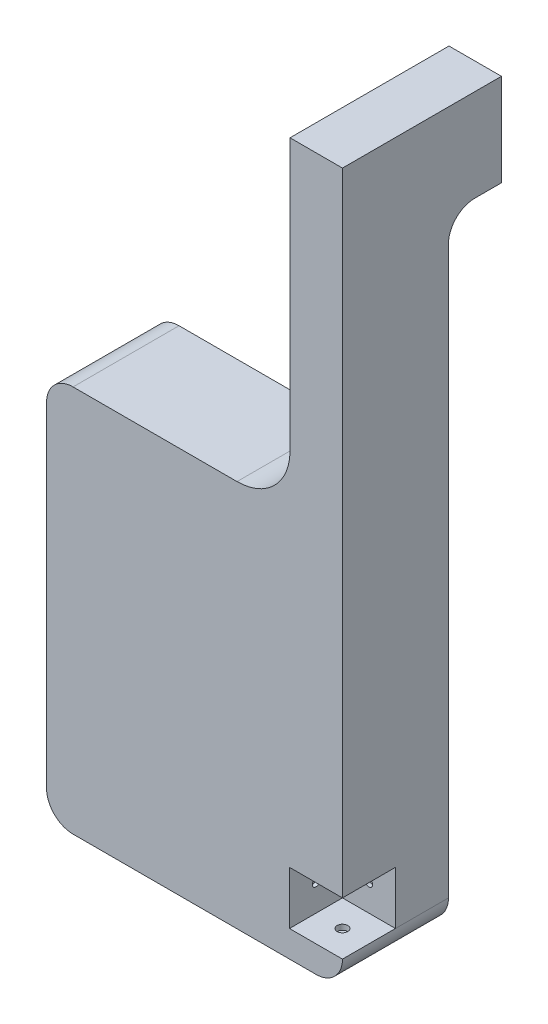
from build123d import *

# Parameters (mm, degrees)
BOSS_EXTRUDE1_DEPTH = 5.08
SKETCH2_W           = 2.514342879
SKETCH2_H           = 4.423428586
BOSS_EXTRUDE2_DEPTH = 2.54
FILLET1_R           = 1.27
SKETCH3_W           = 2.54
SKETCH3_H           = 2.54
CUT_EXTRUDE5_DEPTH  = 2.54
SKETCH7_R           = 0.254
CUT_EXTRUDE6_DEPTH  = 0.254
CUT_EXTRUDE7_START  = -0.254
SKETCH8_R           = 0.254
CUT_EXTRUDE7_DEPTH  = 0.254
SKETCH9_R           = 0.1778
CUT_EXTRUDE8_DEPTH  = 0.1778
SKETCH10_R          = 0.1778
CUT_EXTRUDE9_DEPTH  = 0.1778


with BuildPart() as part:
    # Sketch1 → Boss-Extrude1 (new body)
    with BuildSketch(Plane.XY):
        with BuildLine():
            Line((4.20382112, 20.558512794), (4.20382112, 23.475460042))
            Line((4.20382112, 23.475460042), (6.718163999, 23.475460042))
            Line((6.718163999, 23.475460042), (6.718163999, -9.362397134))
            ThreePointArc((6.718163999, -9.362397134), (6.346189611, -10.260422746), (5.448163999, -10.632397134))
            Line((5.448163999, -10.632397134), (-6.195748899, -10.632397134))
            ThreePointArc((-6.195748899, -10.632397134), (-7.093774512, -10.260422746), (-7.465748899, -9.362397134))
            Line((-7.465748899, -9.362397134), (-7.465748899, 6.663612766))
            ThreePointArc((-7.465748899, 6.663612766), (-7.093774512, 7.561638378), (-6.195748899, 7.933612766))
            Line((-6.195748899, 7.933612766), (1.66382112, 7.933612766))
            ThreePointArc((1.66382112, 7.933612766), (3.459872344, 8.677561542), (4.20382112, 10.473612766))
            Line((4.20382112, 10.473612766), (4.20382112, 20.558512794))
        make_face()
    extrude(amount=BOSS_EXTRUDE1_DEPTH)

    # Sketch2 → Boss-Extrude2 (add)
    with BuildSketch(Plane(origin=(0, 0, 0), x_dir=(-1, 0, 0), z_dir=(0, 0, -1))):
        with Locations((-5.46099256, 21.263745749)):
            Rectangle(SKETCH2_W, SKETCH2_H)
    extrude(amount=BOSS_EXTRUDE2_DEPTH)

    # Fillet1
    fillet1_edges = [part.edges().sort_by_distance(p)[0] for p in [
        (5.46099256, 19.052031456, 0),
    ]]
    fillet(fillet1_edges, radius=FILLET1_R)

    # Sketch3 → Cut-Extrude5 (cut)
    with BuildSketch(Plane.XY.offset(5.08)):
        with Locations((5.448163999, -8.092397134)):
            Rectangle(SKETCH3_W, SKETCH3_H)
    extrude(amount=-CUT_EXTRUDE5_DEPTH, mode=Mode.SUBTRACT)

    # Sketch7 → Cut-Extrude6 (cut)
    with BuildSketch(Plane.XZ.offset(6.822397134)):
        with Locations((5.448163999, 3.81)):
            Circle(SKETCH7_R)
    extrude(amount=-CUT_EXTRUDE6_DEPTH, mode=Mode.SUBTRACT)

    # Sketch8 → Cut-Extrude7 (cut)
    with BuildSketch(Plane(origin=(0, -9.362397134, 0), x_dir=(1, 0, 0), z_dir=(0, 1, 0)).offset(CUT_EXTRUDE7_START)):
        with Locations((5.448163999, -3.81)):
            Circle(SKETCH8_R)
    extrude(amount=CUT_EXTRUDE7_DEPTH, mode=Mode.SUBTRACT)

    # Sketch9 → Cut-Extrude8 (cut)
    with BuildSketch(Plane(origin=(4.178163999, 0, 0), x_dir=(0, 0, -1), z_dir=(1, 0, 0))):
        with Locations((-3.81, -8.092397134)):
            Circle(SKETCH9_R)
    extrude(amount=-CUT_EXTRUDE8_DEPTH, mode=Mode.SUBTRACT)

    # Sketch10 → Cut-Extrude9 (cut)
    with BuildSketch(Plane.XY.offset(2.54)):
        with Locations((5.448163999, -8.092397134)):
            Circle(SKETCH10_R)
    extrude(amount=-CUT_EXTRUDE9_DEPTH, mode=Mode.SUBTRACT)


solid = part.part
